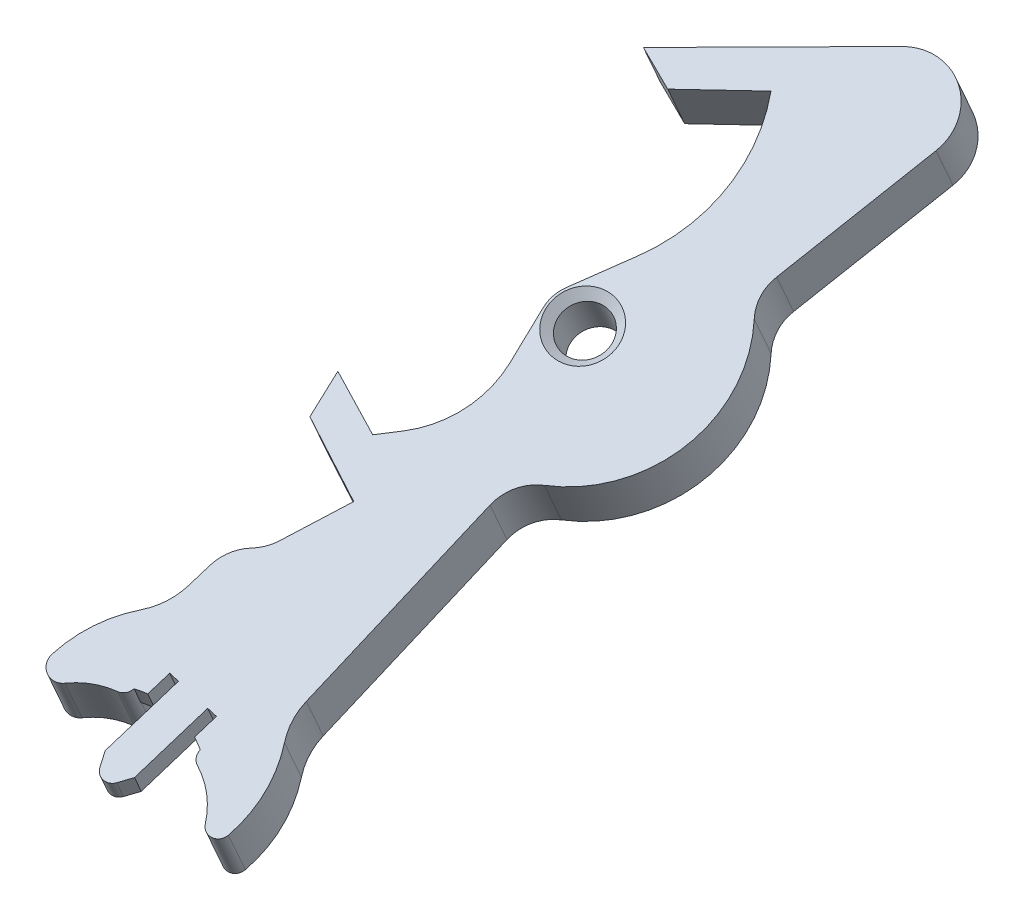
from build123d import *

# Parameters (mm, degrees)
BOSS_EXTRU_1_DEPTH      = 1.2
BOSS_EXTRU_2_DEPTH      = 1.8
BOSS_EXTRU_3_DEPTH      = 1.2
ENL_V_MAT_EXTRU_1_DEPTH = 0.5
D_GAGEMENT_11_D         = 2.2
D_GAGEMENT_11_DEPTH     = 20.852957306
CHANFREIN1_SIZE         = 0.4
CONG_1_R                = 0.5
CONG_2_R                = 1.6
CONG_3_R                = 2
CONG_4_R                = 3
CONG_5_R                = 4.6


with BuildPart() as part:
    # Esquisse1 → Boss.-Extru.1 (new body)
    with BuildSketch(Plane(origin=(6.407585618, 24.446842904, 14.355449102), x_dir=(-0.9673252584845775, 0.25353864458450015, 0), z_dir=(0.22045579862678236, 0.8411043718426235, 0.49390553400326775))):
        with BuildLine():
            Line((8.3107933, -19.201337536), (8.28703703, -20.246295369))
            Line((8.28703703, -20.246295369), (5.887657003, -20.191747407))
            Line((5.887657003, -20.191747407), (5.911413273, -19.146789578))
            ThreePointArc((5.911413273, -19.146789578), (5.661071779, -19.051658576), (5.415896386, -18.943909805))
            Line((5.415896386, -18.943909805), (5.424424098, -18.568804632))
            ThreePointArc((5.424424098, -18.568804632), (4.220103871, -18.05373822), (3.294482937, -17.126966131))
            ThreePointArc((3.294482937, -17.126966131), (2.75302589, -16.9231517), (2.381681142, -17.366794726))
            ThreePointArc((2.381681142, -17.366794726), (2.674699472, -19.679905075), (3.869384364, -21.682170602))
            Line((3.869384364, -21.682170602), (4.36844048, -33.2537312))
            ThreePointArc((4.36844048, -33.2537312), (0.72021692, -37.984660137), (2.965783206, -43.520782952))
            Line((2.965783206, -43.520782952), (2.014262513, -51.497693901))
            ThreePointArc((2.014262513, -51.497693901), (3.190838358, -53.739695244), (5.705653115, -53.445403756))
            Line((5.705653115, -53.445403756), (12.539385017, -47.469897623))
            Line((12.539385017, -47.469897623), (10.775401018, -46.941589091))
            Line((10.775401018, -46.941589091), (7.98794124, -49.26050339))
            ThreePointArc((7.98794124, -49.26050339), (6.551054488, -45.710950333), (7.080832223, -41.918417408))
            Line((7.080832223, -41.918417408), (8.354436867, -38.910332559))
            Line((8.354436867, -38.910332559), (6.961586789, -33.804829327))
            Line((6.961586789, -33.804829327), (9.308655621, -31.135148323))
            Line((9.308655621, -31.135148323), (11.938540853, -31.993635375))
            Line((11.938540853, -31.993635375), (11.460268944, -30.16561351))
            Line((11.460268944, -30.16561351), (8.019985695, -28.956643067))
            Line((8.019985695, -28.956643067), (8.926287357, -26.241418493))
            ThreePointArc((8.926287357, -26.241418493), (9.144900582, -25.787147852), (9.470162743, -25.401975054))
            ThreePointArc((9.470162743, -25.401975054), (9.938854473, -24.754281649), (10.116412195, -23.974761322))
            Line((10.116412195, -23.974761322), (10.163650136, -21.896924134))
            ThreePointArc((10.163650136, -21.896924134), (11.408775744, -20.142199434), (11.914735193, -18.050931496))
            ThreePointArc((11.914735193, -18.050931496), (11.515962336, -17.420273087), (10.787100814, -17.579993788))
            ThreePointArc((10.787100814, -17.579993788), (9.893990524, -18.276347599), (8.823545803, -18.646080909))
            Line((8.823545803, -18.646080909), (8.815018092, -19.021186079))
            ThreePointArc((8.815018092, -19.021186079), (8.565199371, -19.117681561), (8.3107933, -19.201337536))
        make_face()
    extrude(amount=-BOSS_EXTRU_1_DEPTH)

    # Esquisse2 → Boss.-Extru.2 (add)
    with BuildSketch(Plane(origin=(6.14303866, 23.437517658, 13.762762461), x_dir=(0.975396965779486, -0.19010345790327618, -0.11163079521973214), z_dir=(-0.22045579862678244, -0.8411043718426235, -0.493905534003268))):
        with BuildLine():
            Line((-7.732315065, -33.261580929), (-7.492687467, -31.387284642))
            Line((-7.492687467, -31.387284642), (-4.236084553, -29.746645792))
            Line((-4.236084553, -29.746645792), (-5.483474276, -27.170244025))
            ThreePointArc((-5.483474276, -27.170244025), (-5.758598922, -26.747798778), (-6.130618981, -26.407571451))
            ThreePointArc((-6.130618981, -26.407571451), (-6.6785848, -25.825409837), (-6.954750137, -25.075135626))
            Line((-6.954750137, -25.075135626), (-7.268355612, -23.020557711))
            ThreePointArc((-7.268355612, -23.020557711), (-8.728453798, -21.440206536), (-9.498708997, -19.431200941))
            ThreePointArc((-9.498708997, -19.431200941), (-9.184201764, -18.754565869), (-8.440866411, -18.819391589))
            ThreePointArc((-8.440866411, -18.819391589), (-7.465747068, -19.39532291), (-6.356693226, -19.624569933))
            Line((-6.356693226, -19.624569933), (-6.113459598, -21.218108564))
            Line((-6.113459598, -21.218108564), (-2.752387602, -20.7050832))
            Line((-2.752387602, -20.7050832), (-2.99562123, -19.111544567))
            ThreePointArc((-2.99562123, -19.111544567), (-1.86739276, -18.44612655), (-1.068413166, -17.408190027))
            ThreePointArc((-1.068413166, -17.408190027), (-0.557603097, -17.13654848), (-0.132375231, -17.528845966))
            ThreePointArc((-0.132375231, -17.528845966), (-0.126005289, -19.86043312), (-1.053747455, -21.999506214))
            Line((-1.053747455, -21.999506214), (-0.06308502, -33.539378814))
            ThreePointArc((-0.06308502, -33.539378814), (4.162318019, -37.762788918), (2.646077122, -43.541390591))
            Line((2.646077122, -43.541390591), (4.613821412, -51.330131332))
            ThreePointArc((4.613821412, -51.330131332), (3.734816377, -53.704631466), (1.203030531, -53.735634151))
            Line((1.203030531, -53.735634151), (-6.341302035, -48.686910412))
            Line((-6.341302035, -48.686910412), (-4.659741241, -47.936508686))
            Line((-4.659741241, -47.936508686), (-1.59763996, -49.878371526))
            ThreePointArc((-1.59763996, -49.878371526), (-0.628345248, -46.173720638), (-1.640634697, -42.480586398))
            Line((-1.640634697, -42.480586398), (-3.289886063, -39.660903229))
            Line((-3.289886063, -39.660903229), (-2.564020762, -34.418831676))
            Line((-2.564020762, -34.418831676), (-5.234407859, -32.072566236))
            Line((-5.234407859, -32.072566236), (-7.732315065, -33.261580929))
        make_face()
    extrude(amount=BOSS_EXTRU_2_DEPTH)

    # Esquisse3 → Boss.-Extru.3 (add)
    with BuildSketch(Plane(origin=(6.407585618, 24.446842904, 14.355449102), x_dir=(-0.9673252584845775, 0.25353864458450015, 0), z_dir=(0.22045579862678236, 0.8411043718426235, 0.49390553400326775))):
        with BuildLine():
            Line((7.837153276, -20.236067623), (7.91651501, -16.745213642))
            Line((7.91651501, -16.745213642), (7.612088308, -16.189112778))
            ThreePointArc((7.612088308, -16.189112778), (7.184869542, -15.929335708), (6.746286617, -16.169429478))
            Line((6.746286617, -16.169429478), (6.416902492, -16.711121168))
            Line((6.416902492, -16.711121168), (6.337540759, -20.201975149))
            Line((6.337540759, -20.201975149), (7.837153276, -20.236067623))
        make_face()
    extrude(amount=-BOSS_EXTRU_3_DEPTH)

    # Esquisse4 → Enlèv. mat.-Extru.1 (cut)
    with BuildSketch(Plane(origin=(2.951307786, 9.462502662, -17.431643664), x_dir=(0.9891101016622393, -0.07021493892393531, 0.12934863409260489), z_dir=(-0.1471774669904145, -0.47188137397705354, 0.8692909536535013))):
        Polygon((0.512643013, 28.466993484), (-2.801830697, 29.224795587), (-3.203020046, 27.470074211), (0.111453664, 26.712272108), align=None)
    extrude(amount=-ENL_V_MAT_EXTRU_1_DEPTH, mode=Mode.SUBTRACT)

    # Dégagement #11
    with Locations(Plane(origin=(6.407585618, 24.446842904, 14.355449102), x_dir=(0.975396965779486, -0.19010345790327618, -0.11163079521973214), z_dir=(0.22045579862678244, 0.8411043718426235, 0.493905534003268))):
        with Locations((-1.628998725, 39.331434949)):
            Hole(D_GAGEMENT_11_D / 2, depth=D_GAGEMENT_11_DEPTH)

    # Chanfrein1
    chanfrein1_edges = [part.edges().sort_by_distance(p)[0] for p in [
        (5.230234471, 41.940101873, -20.983500369),
        (5.891601867, 44.463414989, -19.501783767),
    ]]
    chamfer(chanfrein1_edges, length=CHANFREIN1_SIZE)

    # Congé1
    # the kernel refuses this fillet: 0.5 mm, written as the material it takes off along each edge
    with BuildSketch(Plane(origin=(-0.669204138, 32.248368886, -3.821283326), x_dir=(0.1471774658030771, 0.4718813743025472, -0.869290953677837), z_dir=(0.2204557986267829, 0.8411043718426239, 0.4939055340032671))) as cong_1_piece_1_section:
        with BuildLine():
            CenterArc((0.390324185, 0.5), CONG_1_R, 196.972621799, 73.027378201)
            ThreePointArc((-0.087897992, 0.354042645), (-0.039267564, 0.178183579), (0, 0))
            Line((0, 0), (0.390324185, 0))
        make_face()
    cong_1_piece_1 = extrude(amount=4.951620926, mode=Mode.PRIVATE)
    cong_1_piece_1 = split(cong_1_piece_1, bisect_by=Plane(origin=(0.003725605, 34.762970093, -2.783803292), z_dir=(-0.22045579862678238, -0.8411043718426235, -0.4939055340032678)), keep=Keep.TOP, mode=Mode.PRIVATE)
    cong_1_piece_1 = cong_1_piece_1 - Plane(origin=(1.037432714, 30.760160969, 0.761385364), x_dir=(-0.25577403854650904, 0.5384942223933797, -0.8028721029245929), z_dir=(0.22045579862678244, 0.8411043718426237, 0.49390553400326787)) * Cylinder(5.260282908, 12, mode=Mode.PRIVATE)
    add(cong_1_piece_1, mode=Mode.SUBTRACT)
    with BuildSketch(Plane(origin=(-0.669204138, 32.248368886, -3.821283326), x_dir=(0.1471774658030771, 0.4718813743025472, -0.869290953677837), z_dir=(0.2204557986267829, 0.8411043718426239, 0.4939055340032671))) as cong_1_piece_2_section:
        with BuildLine():
            CenterArc((0.390324185, 0.5), CONG_1_R, 196.972621799, 73.027378201)
            ThreePointArc((-0.087897992, 0.354042645), (-0.039267564, 0.178183579), (0, 0))
            Line((0, 0), (0.390324185, 0))
        make_face()
    cong_1_piece_2 = extrude(amount=4.951620926, mode=Mode.PRIVATE)
    cong_1_piece_2 = split(cong_1_piece_2, bisect_by=Plane(origin=(-0.122705541, 34.636774261, -2.512463256), z_dir=(-0.22045579862678238, -0.8411043718426235, -0.4939055340032678)), keep=Keep.TOP, mode=Mode.PRIVATE)
    cong_1_piece_2 = cong_1_piece_2 & Plane(origin=(1.037432714, 30.760160969, 0.761385364), x_dir=(-0.25577403854650904, 0.5384942223933797, -0.8028721029245929), z_dir=(0.22045579862678244, 0.8411043718426237, 0.49390553400326787)) * Cylinder(5.260282908, 12, mode=Mode.PRIVATE)
    add(cong_1_piece_2, mode=Mode.SUBTRACT)
    with BuildSketch(Plane(origin=(-0.669204138, 32.248368886, -3.821283326), x_dir=(0.1471774658030771, 0.4718813743025472, -0.869290953677837), z_dir=(0.2204557986267829, 0.8411043718426239, 0.4939055340032671))) as cong_1_piece_3_section:
        with BuildLine():
            CenterArc((0.390324185, 0.5), CONG_1_R, 196.972621799, 73.027378201)
            ThreePointArc((-0.087897992, 0.354042645), (-0.039267564, 0.178183579), (0, 0))
            Line((0, 0), (0.390324185, 0))
        make_face()
    cong_1_piece_3 = extrude(amount=4.951620926, mode=Mode.PRIVATE)
    cong_1_piece_3 = split(cong_1_piece_3, bisect_by=Plane(origin=(-0.122705541, 34.636774261, -2.512463256), z_dir=(0.22045579862678238, 0.8411043718426235, 0.4939055340032678)), keep=Keep.TOP, mode=Mode.PRIVATE)
    cong_1_piece_3 = cong_1_piece_3 & Plane(origin=(1.583239487, 32.842575973, 1.984201853), x_dir=(-0.25577403854650904, 0.5384942223933797, -0.8028721029245929), z_dir=(0.22045579862678244, 0.8411043718426237, 0.49390553400326787)) * Cylinder(5.260282908, 12, mode=Mode.PRIVATE)
    add(cong_1_piece_3, mode=Mode.SUBTRACT)
    with BuildSketch(Plane(origin=(3.221118801, 33.684386414, -2.383102251), x_dir=(0.9003564842206884, -0.3702458044391333, 0.22863999128975734), z_dir=(-0.22045579862678244, -0.8411043718426235, -0.493905534003268))) as cong_1_piece_4:
        with BuildLine():
            CenterArc((0.391217792, -0.49930112), CONG_1_R, 93.029734023, 73.027378136)
            Line((-0.094050404, -0.378823825), (0, 0))
            ThreePointArc((0, 0), (0.182395347, -0.004823551), (0.364790694, 0))
        make_face()
    extrude(amount=2.775810462, mode=Mode.SUBTRACT)
    with BuildSketch(Plane(origin=(3.700788834, 35.514470106, -1.308457423), x_dir=(0.9003564842006331, -0.37024580446021027, 0.2286399913346027), z_dir=(-0.22045579862678238, -0.8411043718426237, -0.49390553400326787))) as cong_1_piece_5_section:
        with BuildLine():
            CenterArc((0.391217792, -0.49930112), CONG_1_R, 93.029734026, 73.027378189)
            Line((-0.094050403, -0.378823826), (0, 0))
            ThreePointArc((0, 0), (0.182395347, -0.004823551), (0.364790695, 0))
        make_face()
    cong_1_piece_5 = extrude(amount=2.175810463, mode=Mode.PRIVATE)
    cong_1_piece_5 = cong_1_piece_5 & Plane(origin=(0.754897734, 33.069656027, 1.967224347), x_dir=(0.43863740070273427, 0.36678352616314214, -0.8204066526059384), z_dir=(0.22045579862678238, 0.8411043718426235, 0.4939055340032678)) * Cylinder(5.260282909, 6, mode=Mode.PRIVATE)
    add(cong_1_piece_5, mode=Mode.SUBTRACT)

    # Congé2
    cong_2_edges = [part.edges().sort_by_distance(p)[0] for p in [
        (2.867957036, 43.89344341, -20.218549127),
    ]]
    fillet(cong_2_edges, radius=CONG_2_R)

    # Congé3
    cong_3_edges = [part.edges().sort_by_distance(p)[0] for p in [
        (8.657877516, 44.729933893, -24.227407519),
        (6.015368983, 40.18030014, -15.300046181),
    ]]
    fillet(cong_3_edges, radius=CONG_3_R)

    # Congé4
    cong_4_edges = [part.edges().sort_by_distance(p)[0] for p in [
        (-1.01263009, 36.223698711, -5.425125631),
        (5.04907985, 34.525256884, -5.238394092),
    ]]
    fillet(cong_4_edges, radius=CONG_4_R)

    # Congé5
    cong_5_edges = [part.edges().sort_by_distance(p)[0] for p in [
        (3.575963848, 41.101059603, -15.779234582),
    ]]
    fillet(cong_5_edges, radius=CONG_5_R)


solid = part.part
